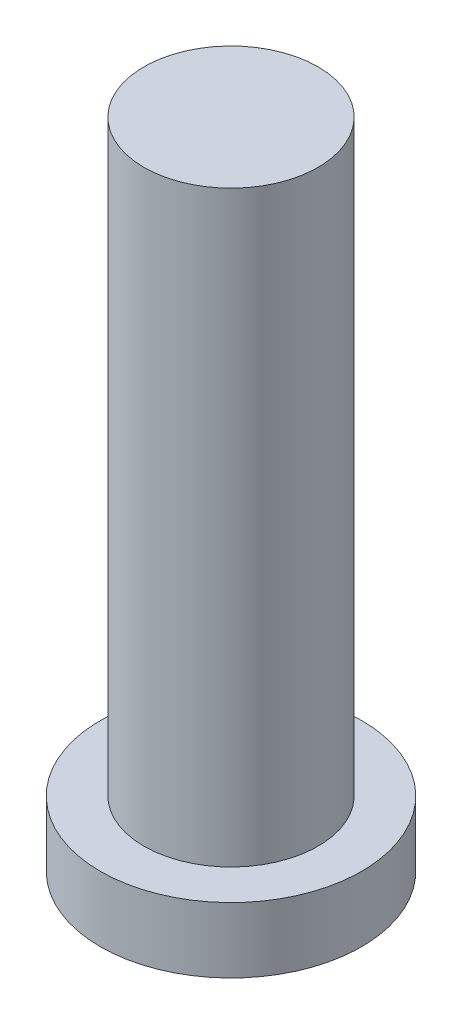
from build123d import *

# Parameters (mm, degrees)
SKETCH1_R           = 3
BOSS_EXTRUDE1_DEPTH = 1.5
SKETCH2_R           = 2
BOSS_EXTRUDE2_DEPTH = 13.5


with BuildPart() as part:
    # Sketch1 → Boss-Extrude1 (new body)
    with BuildSketch(Plane(origin=(0, 0, 0), x_dir=(1, 0, 0), z_dir=(0, 1, 0))):
        Circle(SKETCH1_R)
    extrude(amount=BOSS_EXTRUDE1_DEPTH)

    # Sketch2 → Boss-Extrude2 (add)
    with BuildSketch(Plane(origin=(0, 1.5, 0), x_dir=(1, 0, 0), z_dir=(0, 1, 0))):
        Circle(SKETCH2_R)
    extrude(amount=BOSS_EXTRUDE2_DEPTH)


solid = part.part
